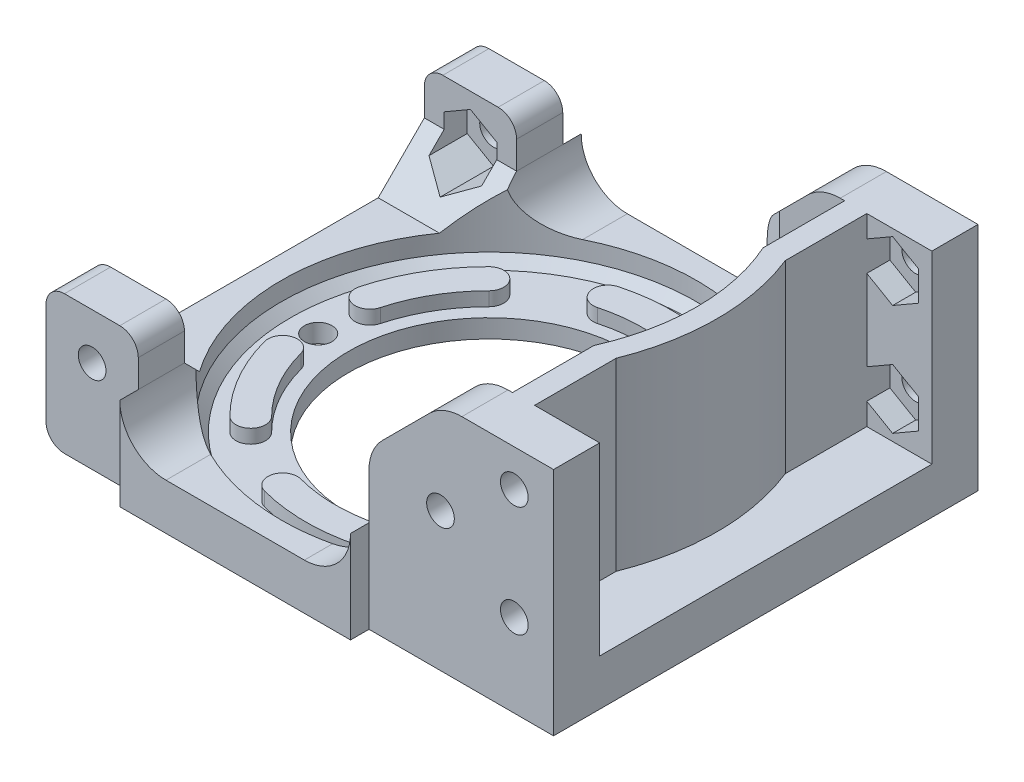
from build123d import *
from build123d.topology import SkipClean

# Parameters (mm, degrees)
SKETCH_1_R                      = 25
EXTRUDE_1_DEPTH                 = 5
SKETCH_23_W                     = 25
SKETCH_23_H                     = 50
EXTRUDE_11_DEPTH                = 5
CUT_EXTRUDE_1_REACH             = 37.707
SKETCH_2_R                      = 15.2
SKETCH_3_R                      = 22.5
CUT_EXTRUDE_2_DEPTH             = 3
CUT_EXTRUDE_3_REACH             = 37.482
SKETCH_4_R                      = 1.5
CHAMFER_1_SIZE                  = 1
EXTRUDE_2_DEPTH                 = 1.5
EXTRUDE_3_DEPTH                 = 5
EXTRUDE_START                   = 20
EXTRUDE_4_DEPTH                 = 20
CUT_EXTRUDE_5_REACH             = 60.086
SKETCH_11_R                     = 1.5
CUT_EXTRUDE_5_DIRECTION_2_DEPTH = 59.086142926
CUT_EXTRUDE_6_DEPTH             = 2.5
SKETCH_26_W                     = 10
SKETCH_26_H                     = 7
EXTRUDE_12_DEPTH                = 10
FILLET_2_R                      = 5
SKETCH_21_W                     = 20
SKETCH_21_H                     = 25
SKETCH_21_W_2                   = 10
SKETCH_21_H_2                   = 15
CUT_EXTRUDE_11_DEPTH            = 2
CUT_EXTRUDE_12_REACH            = 63.879
SKETCH_28_R                     = 1.5
CUT_EXTRUDE_13_DEPTH            = 2.5
CHAMFER_3_SIZE                  = 5
SKETCH_15_W                     = 2.4
SKETCH_15_H                     = 20
EXTRUDE_9_DEPTH                 = 36
CUT_EXTRUDE_8_REACH             = 48.368
SKETCH_14_R                     = 22.5
EXTRUDE_7_DEPTH                 = 20
CHAMFER_4_SIZE                  = 8
FILLET_3_R                      = 5
FILLET_6_R                      = 2


# Read off the part's stored shape, not the designer's step: 镜向3
with BuildPart() as part:
    # 草图1 → 凸台-拉伸1 (new body)
    with BuildSketch(Plane(origin=(0, 0, 0), x_dir=(1, 0, 0), z_dir=(0, 1, 0))):
        with Locations(Location((0, 0, 0), (0, 0, 270))):
            Circle(SKETCH_1_R)
    extrude(amount=EXTRUDE_1_DEPTH)

    # 草图23 → 凸台-拉伸11 (add)
    with BuildSketch(Plane(origin=(0, 0, 0), x_dir=(1, 0, 0), z_dir=(0, 1, 0))):
        with Locations((-12.5, 0)):
            Rectangle(SKETCH_23_W, SKETCH_23_H)
    extrude(amount=EXTRUDE_11_DEPTH)

    # 草图2 → 切除-拉伸1 (cut, up to next)
    with BuildSketch(Plane(origin=(0, 5, 0), x_dir=(1, 0, 0), z_dir=(0, 1, 0)), mode=Mode.PRIVATE) as cut_extrude_1_sk1:
        with Locations(Location((0, 0, 0), (0, 0, 270))):
            Circle(SKETCH_2_R)
    cut_extrude_1_tool1 = extrude(cut_extrude_1_sk1.sketch, amount=-CUT_EXTRUDE_1_REACH, mode=Mode.PRIVATE) & part.part
    add(cut_extrude_1_tool1.solids().sort_by_distance((0, 5, 0))[0], mode=Mode.SUBTRACT)

    # 草图3 → 切除-拉伸2 (cut)
    with BuildSketch(Plane(origin=(0, 5, 0), x_dir=(1, 0, 0), z_dir=(0, 1, 0))):
        with Locations(Location((0, 0, 0), (0, 0, 270))):
            Circle(SKETCH_3_R)
    extrude(amount=-CUT_EXTRUDE_2_DEPTH, mode=Mode.SUBTRACT)

    # 草图4 → 切除-拉伸3 (cut, up to next)
    with BuildSketch(Plane(origin=(0, 2, 0), x_dir=(1, 0, 0), z_dir=(0, 1, 0)), mode=Mode.PRIVATE) as cut_extrude_3_sk1:
        with Locations(Location((9.25, -16.02146997, 0), (0, 0, 270))):
            Circle(SKETCH_4_R)
    cut_extrude_3_tool1 = extrude(cut_extrude_3_sk1.sketch, amount=-CUT_EXTRUDE_3_REACH, mode=Mode.PRIVATE) & part.part
    # 草图4 → 切除-拉伸3 (cut, up to next)
    with BuildSketch(Plane(origin=(0, 2, 0), x_dir=(1, 0, 0), z_dir=(0, 1, 0)), mode=Mode.PRIVATE) as cut_extrude_3_sk2:
        with Locations(Location((-18.5, 0, 0), (0, 0, 270))):
            Circle(SKETCH_4_R)
    cut_extrude_3_tool2 = extrude(cut_extrude_3_sk2.sketch, amount=-CUT_EXTRUDE_3_REACH, mode=Mode.PRIVATE) & part.part
    # 草图4 → 切除-拉伸3 (cut, up to next)
    with BuildSketch(Plane(origin=(0, 2, 0), x_dir=(1, 0, 0), z_dir=(0, 1, 0)), mode=Mode.PRIVATE) as cut_extrude_3_sk3:
        with Locations(Location((9.25, 16.02146997, 0), (0, 0, 270))):
            Circle(SKETCH_4_R)
    cut_extrude_3_tool3 = extrude(cut_extrude_3_sk3.sketch, amount=-CUT_EXTRUDE_3_REACH, mode=Mode.PRIVATE) & part.part
    add(cut_extrude_3_tool1.solids().sort_by_distance((9.25, 2, 16.02147))[0], mode=Mode.SUBTRACT)
    add(cut_extrude_3_tool2.solids().sort_by_distance((-18.5, 2, 0))[0], mode=Mode.SUBTRACT)
    add(cut_extrude_3_tool3.solids().sort_by_distance((9.25, 2, -16.02147))[0], mode=Mode.SUBTRACT)

    # 倒角1
    chamfer_1_edges = [part.edges().sort_by_distance(p)[0] for p in [
        (0, 2, -22.5),
    ]]
    chamfer(chamfer_1_edges, length=CHAMFER_1_SIZE)

    # 草图7 → 凸台-拉伸2 (add)
    with BuildSketch(Plane(origin=(0, 2, 0), x_dir=(1, 0, 0), z_dir=(0, 1, 0))):
        with BuildLine():
            ThreePointArc((5.137558045, 19.173627652), (0, 19.85), (-5.137558045, 19.173627652))
            ThreePointArc((-5.137558045, 19.173627652), (-6.268928895, 17.214035858), (-4.309337101, 16.082665008))
            ThreePointArc((-4.309337101, 16.082665008), (0, 16.65), (4.309337101, 16.082665008))
            ThreePointArc((4.309337101, 16.082665008), (6.268928895, 17.214035858), (5.137558045, 19.173627652))
        make_face()
        with BuildLine():
            ThreePointArc((19.173627652, 5.137558045), (17.190604265, 9.925), (14.036069607, 14.036069607))
            ThreePointArc((14.036069607, 14.036069607), (11.773327907, 14.036069607), (11.773327907, 11.773327907))
            ThreePointArc((11.773327907, 11.773327907), (14.419322973, 8.325), (16.082665008, 4.309337101))
            ThreePointArc((16.082665008, 4.309337101), (18.042256802, 3.177966251), (19.173627652, 5.137558045))
        make_face()
        with BuildLine():
            ThreePointArc((14.036069607, -14.036069607), (17.190604265, -9.925), (19.173627652, -5.137558045))
            ThreePointArc((19.173627652, -5.137558045), (18.042256802, -3.177966251), (16.082665008, -4.309337101))
            ThreePointArc((16.082665008, -4.309337101), (14.419322973, -8.325), (11.773327907, -11.773327907))
            ThreePointArc((11.773327907, -11.773327907), (11.773327907, -14.036069607), (14.036069607, -14.036069607))
        make_face()
        with BuildLine():
            ThreePointArc((-5.137558045, -19.173627652), (0, -19.85), (5.137558045, -19.173627652))
            ThreePointArc((5.137558045, -19.173627652), (6.268928895, -17.214035858), (4.309337101, -16.082665008))
            ThreePointArc((4.309337101, -16.082665008), (0, -16.65), (-4.309337101, -16.082665008))
            ThreePointArc((-4.309337101, -16.082665008), (-6.268928895, -17.214035858), (-5.137558045, -19.173627652))
        make_face()
        with BuildLine():
            ThreePointArc((-19.173627652, -5.137558045), (-17.190604265, -9.925), (-14.036069607, -14.036069607))
            ThreePointArc((-14.036069607, -14.036069607), (-11.773327907, -14.036069607), (-11.773327907, -11.773327907))
            ThreePointArc((-11.773327907, -11.773327907), (-14.419322973, -8.325), (-16.082665008, -4.309337101))
            ThreePointArc((-16.082665008, -4.309337101), (-18.042256802, -3.177966251), (-19.173627652, -5.137558045))
        make_face()
        with BuildLine():
            ThreePointArc((-14.036069607, 14.036069607), (-17.190604265, 9.925), (-19.173627652, 5.137558045))
            ThreePointArc((-19.173627652, 5.137558045), (-18.042256802, 3.177966251), (-16.082665008, 4.309337101))
            ThreePointArc((-16.082665008, 4.309337101), (-14.419322973, 8.325), (-11.773327907, 11.773327907))
            ThreePointArc((-11.773327907, 11.773327907), (-11.773327907, 14.036069607), (-14.036069607, 14.036069607))
        make_face()
    extrude(amount=EXTRUDE_2_DEPTH)

    # 草图8 → 凸台-拉伸3 (add)
    with BuildSketch(Plane(origin=(0, 0, 0), x_dir=(1, 0, 0), z_dir=(0, 1, 0))):
        with BuildLine():
            Line((0, 25), (30, 25))
            Line((30, 25), (30, -25))
            Line((30, -25), (0, -25))
            ThreePointArc((0, -25), (25, 0), (0, 25))
        make_face()
    extrude(amount=EXTRUDE_3_DEPTH)

    # 草图9 → 凸台-拉伸4 (add)
    with SkipClean():  # the faces are left unmerged after this step: merging them gives an invalid solid
        with BuildSketch(Plane(origin=(0, 5, 0), x_dir=(1, 0, 0), z_dir=(0, 1, 0)).offset(EXTRUDE_START)):
            with BuildLine():
                Line((13.5, 18), (30, 18))
                Line((30, 18), (30, 25))
                Line((30, 25), (10, 25))
                Line((10, 25), (10, 20.155644371))
                ThreePointArc((10, 20.155644371), (11.799330518, 19.157917406), (13.5, 18))
            make_face()
        extrude(amount=-EXTRUDE_4_DEPTH)

    # 草图11 → 切除-拉伸5 (cut, up to next)
    with BuildSketch(Plane.XY.offset(-18), mode=Mode.PRIVATE) as cut_extrude_5_sk1:
        with Locations(Location((17.75, 15, 0), (0, 0, 180))):
            Circle(SKETCH_11_R)
    cut_extrude_5_tool1 = extrude(cut_extrude_5_sk1.sketch, amount=-CUT_EXTRUDE_5_REACH, mode=Mode.PRIVATE) & part.part
    # 草图11 → 切除-拉伸5 (cut, up to next)
    with BuildSketch(Plane.XY.offset(-18), mode=Mode.PRIVATE) as cut_extrude_5_sk2:
        with Locations(Location((25.75, 21, 0), (0, 0, 180))):
            Circle(SKETCH_11_R)
    cut_extrude_5_tool2 = extrude(cut_extrude_5_sk2.sketch, amount=-CUT_EXTRUDE_5_REACH, mode=Mode.PRIVATE) & part.part
    # 草图11 → 切除-拉伸5 (cut, up to next)
    with BuildSketch(Plane.XY.offset(-18), mode=Mode.PRIVATE) as cut_extrude_5_sk3:
        with Locations(Location((25.75, 9, 0), (0, 0, 180))):
            Circle(SKETCH_11_R)
    cut_extrude_5_tool3 = extrude(cut_extrude_5_sk3.sketch, amount=-CUT_EXTRUDE_5_REACH, mode=Mode.PRIVATE) & part.part
    add(cut_extrude_5_tool1.solids().sort_by_distance((17.75, 15, -18))[0], mode=Mode.SUBTRACT)
    add(cut_extrude_5_tool2.solids().sort_by_distance((25.75, 21, -18))[0], mode=Mode.SUBTRACT)
    add(cut_extrude_5_tool3.solids().sort_by_distance((25.75, 9, -18))[0], mode=Mode.SUBTRACT)

    # 草图11 → 切除-拉伸5 direction 2 (cut)
    with SkipClean():  # the faces are left unmerged after this step: merging them gives an invalid solid
        with BuildSketch(Plane.XY.offset(-18)):
            with Locations(Location((17.75, 15, 0), (0, 0, 180))):
                Circle(SKETCH_11_R)
            with Locations(Location((25.75, 21, 0), (0, 0, 180))):
                Circle(SKETCH_11_R)
            with Locations(Location((25.75, 9, 0), (0, 0, 180))):
                Circle(SKETCH_11_R)
        extrude(amount=CUT_EXTRUDE_5_DIRECTION_2_DEPTH, mode=Mode.SUBTRACT)

    # 草图12 → 切除-拉伸6 (cut)
    with SkipClean():  # the faces are left unmerged after this step: merging them gives an invalid solid
        with BuildSketch(Plane.XY.offset(-18)):
            Polygon((28.55, 22.616580754), (25.75, 24.233161507), (22.95, 22.616580754), (22.95, 19.383419246), (25.75, 17.766838493), (28.55, 19.383419246), align=None)
            Polygon((28.55, 10.616580754), (25.75, 12.233161507), (22.95, 10.616580754), (22.95, 7.383419246), (25.75, 5.766838493), (28.55, 7.383419246), align=None)
            Polygon((20.55, 16.616580754), (17.75, 18.233161507), (14.95, 16.616580754), (14.95, 13.383419246), (17.75, 11.766838493), (20.55, 13.383419246), align=None)
        extrude(amount=-CUT_EXTRUDE_6_DEPTH, mode=Mode.SUBTRACT)

    # 草图26 → 凸台-拉伸12 (add)
    with SkipClean():  # the faces are left unmerged after this step: merging them gives an invalid solid
        with BuildSketch(Plane(origin=(0, 5, 0), x_dir=(1, 0, 0), z_dir=(0, 1, 0))):
            with Locations((-20, 21.5)):
                Rectangle(SKETCH_26_W, SKETCH_26_H)
        extrude(amount=EXTRUDE_12_DEPTH)

    # 圆角2
    # the kernel refuses this fillet: 5 mm, written as the material it adds along each edge
    with BuildSketch(Plane(origin=(10, 5, -25), x_dir=(-1, 0, 0), z_dir=(0, 0, 1))) as fillet_2_piece_1_section:
        with BuildLine():
            CenterArc((FILLET_2_R, -FILLET_2_R), FILLET_2_R, 90, 90)
            Line((0, -FILLET_2_R), (0, 0))
            Line((0, 0), (FILLET_2_R, 0))
        make_face()
    fillet_2_piece_1 = extrude(amount=17.344355629, mode=Mode.PRIVATE)
    fillet_2_piece_1 = fillet_2_piece_1 - Plane(origin=(0, 6.196795152, 0), x_dir=(0, 0, 1), z_dir=(0, 1, 0)) * Cylinder(22.5, 55, mode=Mode.PRIVATE)
    add(fillet_2_piece_1)
    with BuildSketch(Plane(origin=(-15, 5, -25), x_dir=(1, 0, 0), z_dir=(0, 0, 1))) as fillet_2_piece_2_section:
        with BuildLine():
            CenterArc((FILLET_2_R, FILLET_2_R), FILLET_2_R, 180, 90)
            Line((0, FILLET_2_R), (0, 0))
            Line((0, 0), (FILLET_2_R, 0))
        make_face()
    fillet_2_piece_2 = extrude(amount=7, mode=Mode.PRIVATE)
    fillet_2_piece_2 = fillet_2_piece_2 - Plane(origin=(0, 6.161107278, 0), x_dir=(0, 0, 1), z_dir=(0, 1, 0)) * Cylinder(22.5, 34, mode=Mode.PRIVATE)
    add(fillet_2_piece_2)

    # 草图21 → 切除-拉伸11 (cut)
    with BuildSketch(Plane(origin=(0, 0, -25), x_dir=(-1, 0, 0), z_dir=(0, 0, -1))):
        with Locations((-20, 12.5)):
            Rectangle(SKETCH_21_W, SKETCH_21_H)
        with Locations((20, 7.5)):
            Rectangle(SKETCH_21_W_2, SKETCH_21_H_2)
    extrude(amount=-CUT_EXTRUDE_11_DEPTH, mode=Mode.SUBTRACT)

    # 草图28 → 切除-拉伸12 (cut, up to next)
    with BuildSketch(Plane(origin=(0, 0, -23), x_dir=(-1, 0, 0), z_dir=(0, 0, -1)), mode=Mode.PRIVATE) as cut_extrude_12_sk1:
        with Locations((20, 10)):
            Circle(SKETCH_28_R)
    cut_extrude_12_tool1 = extrude(cut_extrude_12_sk1.sketch, amount=-CUT_EXTRUDE_12_REACH, mode=Mode.PRIVATE) & part.part
    add(cut_extrude_12_tool1.solids().sort_by_distance((-20, 10, -23))[0], mode=Mode.SUBTRACT)

    # 草图29 → 切除-拉伸13 (cut)
    with BuildSketch(Plane.XY.offset(-18)):
        Polygon((-20, 6.709103466), (-17.15, 8.354551733), (-17.15, 11.645448267), (-20, 13.290896534), (-22.85, 11.645448267), (-22.85, 8.354551733), align=None)
    extrude(amount=-CUT_EXTRUDE_13_DEPTH, mode=Mode.SUBTRACT)

    # 倒角3
    # the kernel refuses this chamfer: 5 mm, written as the material it adds along each edge
    with BuildSketch(Plane(origin=(-15, 5, -18), x_dir=(0, 0.9996219169112968, -0.027495876610586317), z_dir=(-1, 0, 0))) as chamfer_3_piece_1_section:
        Polygon((CHAMFER_3_SIZE * 0.999621916911, -CHAMFER_3_SIZE * 0.0274958766106), (-CHAMFER_3_SIZE * 0.0274958766106, -CHAMFER_3_SIZE * 0.999621916911), (0, 0), align=None)
    chamfer_3_piece_1 = extrude(amount=22.85841494, mode=Mode.PRIVATE)
    chamfer_3_piece_1 = chamfer_3_piece_1 - Plane(origin=(0, 9.167941379, 0), x_dir=(0, 0, 1), z_dir=(0, 1, 0)) * Cylinder(22.5, 66, mode=Mode.PRIVATE)
    chamfer_3_piece_1 = split(chamfer_3_piece_1, bisect_by=Plane(origin=(-17.15, 9.167941379, -17.58397069), z_dir=(1, 0, 0)), keep=Keep.TOP, mode=Mode.PRIVATE)
    add(chamfer_3_piece_1)
    with BuildSketch(Plane(origin=(-15, 5, -18), x_dir=(0, 0.9996219169112968, -0.027495876610586317), z_dir=(-1, 0, 0))) as chamfer_3_piece_2_section:
        Polygon((CHAMFER_3_SIZE * 0.999621916911, -CHAMFER_3_SIZE * 0.0274958766106), (-CHAMFER_3_SIZE * 0.0274958766106, -CHAMFER_3_SIZE * 0.999621916911), (0, 0), align=None)
    chamfer_3_piece_2 = extrude(amount=22.85841494, mode=Mode.PRIVATE)
    chamfer_3_piece_2 = chamfer_3_piece_2 - Plane(origin=(0, 6.593043937, 0), x_dir=(0, 0, 1), z_dir=(0, 1, 0)) * Cylinder(22.5, 66, mode=Mode.PRIVATE)
    chamfer_3_piece_2 = split(chamfer_3_piece_2, bisect_by=Plane(origin=(-18.636843472, 7.496122254, -16.334895417), z_dir=(0.5000000000000009, -0.8660254037844382, 0)), keep=Keep.TOP, mode=Mode.PRIVATE)
    add(chamfer_3_piece_2)
    with BuildSketch(Plane(origin=(-15, 5, -18), x_dir=(0, 0.9996219169112968, -0.027495876610586317), z_dir=(-1, 0, 0))) as chamfer_3_piece_3_section:
        Polygon((CHAMFER_3_SIZE * 0.999621916911, -CHAMFER_3_SIZE * 0.0274958766106), (-CHAMFER_3_SIZE * 0.0274958766106, -CHAMFER_3_SIZE * 0.999621916911), (0, 0), align=None)
    chamfer_3_piece_3 = extrude(amount=10, mode=Mode.PRIVATE)
    chamfer_3_piece_3 = split(chamfer_3_piece_3, bisect_by=Plane(origin=(-21.484375, 5.85209916, -16.285991388), z_dir=(-0.5000000000000009, 0.8660254037844382, 0)), keep=Keep.TOP, mode=Mode.PRIVATE)
    chamfer_3_piece_3 = split(chamfer_3_piece_3, bisect_by=Plane(origin=(-21.365625, 7.497547427, -16.285991388), z_dir=(-0.5000000000000001, -0.8660254037844386, 0)), keep=Keep.TOP, mode=Mode.PRIVATE)
    add(chamfer_3_piece_3)
    with BuildSketch(Plane(origin=(-15, 5, -18), x_dir=(0, 0.9996219169112968, -0.027495876610586317), z_dir=(-1, 0, 0))) as chamfer_3_piece_4_section:
        Polygon((CHAMFER_3_SIZE * 0.999621916911, -CHAMFER_3_SIZE * 0.0274958766106), (-CHAMFER_3_SIZE * 0.0274958766106, -CHAMFER_3_SIZE * 0.999621916911), (0, 0), align=None)
    chamfer_3_piece_4 = extrude(amount=10, mode=Mode.PRIVATE)
    chamfer_3_piece_4 = split(chamfer_3_piece_4, bisect_by=Plane(origin=(-22.85, 9.167941379, -17.58397069), z_dir=(-1, 0, 0)), keep=Keep.TOP, mode=Mode.PRIVATE)
    add(chamfer_3_piece_4)
    with BuildSketch(Plane(origin=(-15, 5, -18), x_dir=(0, 0.9996219169112968, -0.027495876610586317), z_dir=(1, 0, 0))) as chamfer_3_piece_5_section:
        Polygon((CHAMFER_3_SIZE * 0.999621916911, CHAMFER_3_SIZE * 0.0274958766106), (-CHAMFER_3_SIZE * 0.0274958766106, CHAMFER_3_SIZE * 0.999621916911), (0, 0), align=None)
    chamfer_3_piece_5 = extrude(amount=14.35841494, mode=Mode.PRIVATE)
    chamfer_3_piece_5 = chamfer_3_piece_5 - Plane(origin=(-10, 10, -17.561871944), x_dir=(1, 0, 0), z_dir=(0, 0, -1)) * Cylinder(5, 49, mode=Mode.PRIVATE)
    chamfer_3_piece_5 = chamfer_3_piece_5 - Plane(origin=(0, 6.59714937, 0), x_dir=(0, 0, 1), z_dir=(0, 1, 0)) * Cylinder(22.5, 49, mode=Mode.PRIVATE)
    add(chamfer_3_piece_5)

    # 镜向3
    split(bisect_by=Plane.XY, keep=Keep.BOTTOM)

    # Mirror 3 2: part across plane


with BuildPart() as part_1:
    add(part.part)
    add(part.part.mirror(Plane.XY))

    # 草图15 → 凸台-拉伸9 (add)
    with BuildSketch(Plane.XY.offset(-18)):
        with Locations((21.75, 15)):
            Rectangle(SKETCH_15_W, SKETCH_15_H)
    extrude(amount=EXTRUDE_9_DEPTH)

    # 草图14 → 切除-拉伸8 (cut, up to next)
    with BuildSketch(Plane(origin=(0, 25, 0), x_dir=(1, 0, 0), z_dir=(0, 1, 0)), mode=Mode.PRIVATE) as cut_extrude_8_sk1:
        with Locations(Location((0, 0, 0), (0, 0, 270))):
            Circle(SKETCH_14_R)
    cut_extrude_8_tool1 = extrude(cut_extrude_8_sk1.sketch, amount=-CUT_EXTRUDE_8_REACH, mode=Mode.PRIVATE) & part_1.part
    add(cut_extrude_8_tool1.solids().sort_by_distance((0, 25, 0))[0], mode=Mode.SUBTRACT)

    # 草图16 → 凸台-拉伸7 (add)
    with BuildSketch(Plane(origin=(0, 5, 0), x_dir=(1, 0, 0), z_dir=(0, 1, 0))):
        with BuildLine():
            Line((22.95, 9.162286832), (22.95, -9.162286832))
            ThreePointArc((22.95, -9.162286832), (24.711333432, 0), (22.95, 9.162286832))
        make_face()
    extrude(amount=EXTRUDE_7_DEPTH)

    # 倒角4
    chamfer_4_edges = [part_1.edges().sort_by_distance(p)[0] for p in [
        (10, 25, 21.577822185),
        (10, 25, -21.577822185),
    ]]
    chamfer(chamfer_4_edges, length=CHAMFER_4_SIZE)

    # 圆角3
    fillet_3_edges = [part_1.edges().sort_by_distance(p)[0] for p in [
        (10, 17, 21.577822185),
        (18, 25, 20.5),
        (10, 17, -21.577822185),
        (18, 25, -20.5),
    ]]
    fillet(fillet_3_edges, radius=FILLET_3_R)

    # 圆角6
    fillet_6_edges = [part_1.edges().sort_by_distance(p)[0] for p in [
        (-15, 15, -20.5),
        (-25, 15, -20.5),
        (-25, 0, 0),
        (-15, 15, 20.5),
        (-25, 15, 20.5),
    ]]
    fillet(fillet_6_edges, radius=FILLET_6_R)


solid = part_1.part
